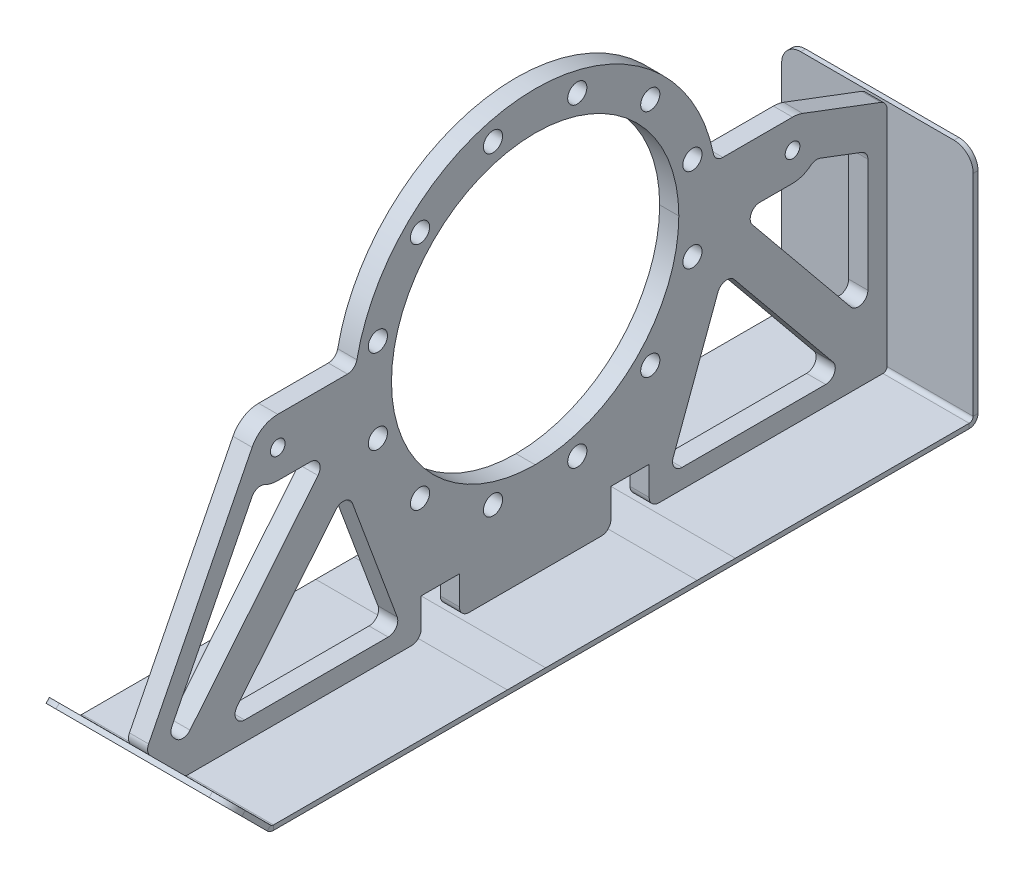
from build123d import *

# Parameters (mm, degrees)
FLANGE_PROFILE_DEPTH                = 12.7
F_7_8_1_DIAMETER_HOLE1_D            = 25.4
BOLT_PATTERN_COUNT                  = 12
SKETCH15_R                          = 9.72312
BOSS_EXTRUDE1_DEPTH                 = 12.7
SKETCH5_W                           = 254
SKETCH5_H                           = 1317.865260112
BASE_SKID_DEPTH                     = 6.35
BEND_START                          = -127
BEND_HEEL_DEPTH                     = 254
BEND_HEEL_2_DEPTH                   = 254
BEND_TOE_DEPTH                      = 254
BEND_TOE_2_DEPTH                    = 254
WEBBING_EXTRUDE_DEPTH               = 12.7
WEBBING_FILLET_R                    = 12.7
SKID_START                          = -472.929130056
SKID_EDGES_DEPTH                    = 6.35
SKID_START_2                        = -334.061851681
SKID_EDGES_2_DEPTH                  = 6.35
FLANGE_FILLET_R                     = 12.7
CONVERT_START                       = -12.7
CONVERT_FLANGE_TO_SHEET_OUTLINE_R   = 12.7
CONVERT_FLANGE_TO_SHEET_OUTLINE_R_2 = 9.72312
CONVERT_FLANGE_TO_SHEET_OUTLINE_R_3 = 190.5
CONVERT_FLANGE_TO_SHEET_DEPTH       = 25.4


# Read off the part's stored shape, not the designer's step: Bend Heel, Bend Toe, Skid Edges, Convert Flange to Sheet
# Sheet-metal steps are written as plain solids
with BuildPart() as part:
    # Sketch1 → Flange Profile (new, symmetric)
    with BuildSketch(Plane(origin=(0, 0, 0), x_dir=(0, 0, -1), z_dir=(1, 0, 0))):
        with BuildLine():
            ThreePointArc((-190.5, 316.3), (0, 506.8), (190.5, 316.3))
            Line((190.5, 316.3), (241.3, 316.3))
            ThreePointArc((241.3, 316.3), (0, 557.6), (-241.3, 316.3))
            Line((-241.3, 316.3), (-190.5, 316.3))
        make_face()
        with BuildLine():
            Line((241.3, 316.3), (190.5, 316.3))
            ThreePointArc((190.5, 316.3), (0, 125.8), (-190.5, 316.3))
            Line((-190.5, 316.3), (-241.3, 316.3))
            ThreePointArc((-241.3, 316.3), (0, 75), (241.3, 316.3))
        make_face()
    extrude(amount=FLANGE_PROFILE_DEPTH, both=True)

    # 7/8 (1) Diameter Hole1 (through all)
    with Locations(Plane(origin=(12.7, 260.420968162, -208.543385896), x_dir=(0, 0, 1), z_dir=(1, 0, 0))):
        with Locations((0, 0)):
            f_7_8_1_diameter_hole1 = Hole(F_7_8_1_DIAMETER_HOLE1_D / 2)

    # Bolt Pattern: 7/8 (1) Diameter Hole1 ×12 about axis
    bolt_pattern_axis = Axis((0, 316.3, 0), (1, 0, 0))
    for i in range(1, BOLT_PATTERN_COUNT):
        add(f_7_8_1_diameter_hole1.rotate(bolt_pattern_axis, i * 360 / BOLT_PATTERN_COUNT), mode=Mode.SUBTRACT)

    # Sketch15 → Boss-Extrude1 (add, symmetric)
    with BuildSketch(Plane(origin=(0, 0, 0), x_dir=(0, 0, -1), z_dir=(1, 0, 0))):
        with BuildLine():
            Line((-238.273120599, 278.2), (-341.3, 278.2))
            ThreePointArc((-341.3, 278.2), (-379.4, 316.3), (-341.3, 354.4))
            Line((-341.3, 354.4), (-238.273120599, 354.4))
            ThreePointArc((-238.273120599, 354.4), (-200.173120599, 316.3), (-238.273120599, 278.2))
        make_face()
        with Locations((-341.3, 316.3)):
            Circle(SKETCH15_R, mode=Mode.SUBTRACT)
    boss_extrude1 = extrude(amount=BOSS_EXTRUDE1_DEPTH, both=True)

    # Mirror2: Boss-Extrude1 across plane
    add(boss_extrude1.mirror(Plane.XY))

    # webbing → Webbing Extrude (add, symmetric)
    with BuildSketch(Plane(origin=(0, 0, 0), x_dir=(0, 0, -1), z_dir=(1, 0, 0))):
        with BuildLine():
            ThreePointArc((238.273120599, 278.2), (0, 75), (-238.273120599, 278.2))
            Line((-238.273120599, 278.2), (-271.07641131, 278.2))
            Line((-271.07641131, 278.2), (-466.535353829, 39.001833116))
            Line((-466.535353829, 39.001833116), (-485.744094857, 58.210574144))
            Line((-485.744094857, 58.210574144), (-380.664844281, 266.473711409))
            Line((-380.664844281, 266.473711409), (-368.819522655, 289.950695021))
            ThreePointArc((-368.819522655, 289.950695021), (-378.982374479, 310.674286388), (-375.315537192, 333.462553119))
            Line((-375.315537192, 333.462553119), (-516.69946035, 53.244915153))
            Line((-516.69946035, 53.244915153), (-465.016837626, 1.562292429))
            ThreePointArc((-465.016837626, 1.562292429), (-463.286363484, 0.406026574), (-461.245130056, 0))
            Line((-461.245130056, 0), (-151.213153751, 0))
            Line((-151.213153751, 0), (-151.213153751, 50.8))
            Line((-151.213153751, 50.8), (-100.413153751, 50.8))
            Line((-100.413153751, 50.8), (-100.413153751, 0))
            Line((-100.413153751, 0), (100.413153751, 0))
            Line((100.413153751, 0), (100.413153751, 50.8))
            Line((100.413153751, 50.8), (151.213153751, 50.8))
            Line((151.213153751, 50.8), (151.213153751, 0))
            Line((151.213153751, 0), (176.613153751, 0))
            Line((176.613153751, 0), (461.245130056, 0))
            ThreePointArc((461.245130056, 0), (465.016837626, 1.562292429), (466.579130056, 5.334))
            Line((466.579130056, 5.334), (466.579130056, 309.66453199))
            Line((466.579130056, 309.66453199), (354.774573435, 351.937702939))
            ThreePointArc((354.774573435, 351.937702939), (378.177611201, 325.873494246), (370.408024073, 291.716816021))
            Line((370.408024073, 291.716816021), (441.179130056, 264.958344347))
            Line((441.179130056, 264.958344347), (441.179130056, 70.03219769))
            Line((441.179130056, 70.03219769), (271.07641131, 278.2))
            Line((271.07641131, 278.2), (238.273120599, 278.2))
        make_face()
        Polygon((-176.613153751, 25.4), (-412.046717792, 25.4), (-250.076782577, 223.615088522), align=None, mode=Mode.SUBTRACT)
        Polygon((412.046717792, 25.4), (176.613153751, 25.4), (250.076782577, 223.615088522), align=None, mode=Mode.SUBTRACT)
    extrude(amount=WEBBING_EXTRUDE_DEPTH, both=True)

    # Webbing Fillet
    webbing_fillet_edges = [part.edges().sort_by_distance(p)[0] for p in [
        (0, 223.615088522, 250.076782577),
        (0, 289.950695021, 368.819522655),
        (0, 291.716816021, -370.408024073),
        (0, 264.958344347, -441.179130056),
        (0, 70.03219769, -441.179130056),
        (0, 278.2, -271.07641131),
        (0, 278.2, 271.07641131),
        (0, 39.001833116, 466.535353829),
        (0, 25.4, -412.046717792),
        (0, 25.4, -176.613153751),
        (0, 58.210574144, 485.744094857),
        (0, 223.615088522, -250.076782577),
        (0, 25.4, 176.613153751),
        (0, 25.4, 412.046717792),
    ]]
    fillet(webbing_fillet_edges, radius=WEBBING_FILLET_R)

    # Flange Fillet
    flange_fillet_edges = [part.edges().sort_by_distance(p)[0] for p in [
        (0, 53.244915153, 516.69946035),
        (0, 0, 151.213153751),
        (0, 0, 100.413153751),
        (0, 0, -100.413153751),
        (0, 0, -151.213153751),
        (0, 309.66453199, -466.579130056),
        (0, 354.4, 238.273120599),
        (0, 354.4, -238.273120599),
    ]]
    fillet(flange_fillet_edges, radius=FLANGE_FILLET_R)


with BuildPart() as body_2:
    # Sketch5 → Base Skid (new body)
    with BuildSketch(Plane(origin=(0, 0, 0), x_dir=(1, 0, 0), z_dir=(0, 1, 0))):
        with Locations((0, 118.6125)):
            Rectangle(SKETCH5_W, SKETCH5_H)
    extrude(amount=-BASE_SKID_DEPTH)

    # Bend Heel outline → Bend Heel (cut)
    with BuildSketch(Plane.YZ.offset(BEND_START)):
        with BuildLine():
            Line((0, -777.545130056), (0, -471.640528076))
            ThreePointArc((0, -471.640528076), (-4.636915504, -467.33583609), (-6.35, -461.245130056))
            Line((-6.35, -461.245130056), (-6.35, -777.545130056))
            Line((-6.35, -777.545130056), (0, -777.545130056))
        make_face()
    extrude(amount=BEND_HEEL_DEPTH, mode=Mode.SUBTRACT)

    # Bend Heel 2 outline → Bend Heel 2 (add)
    with BuildSketch(Plane.YZ.offset(BEND_START)):
        with BuildLine():
            Line((5.334, -472.929130056), (309.66453199, -472.929130056))
            Line((309.66453199, -472.929130056), (309.66453199, -466.579130056))
            Line((309.66453199, -466.579130056), (5.334, -466.579130056))
            ThreePointArc((5.334, -466.579130056), (1.56229243, -465.016837626), (0, -461.245130056))
            Line((0, -461.245130056), (0, -471.640528076))
            ThreePointArc((0, -471.640528076), (2.590277571, -472.602411563), (5.334, -472.929130056))
        make_face()
    extrude(amount=BEND_HEEL_2_DEPTH)

    # Bend Toe outline → Bend Toe (cut)
    with BuildSketch(Plane.YZ.offset(BEND_START)):
        with BuildLine():
            Line((-6.35, 540.320130056), (-6.35, 461.245130056))
            ThreePointArc((-6.35, 461.245130056), (-5.460608458, 465.71640328), (-2.927835631, 469.506965687))
            Line((-2.927835631, 469.506965687), (0, 472.434801318))
            Line((0, 472.434801318), (0, 540.320130056))
            Line((0, 540.320130056), (-6.35, 540.320130056))
        make_face()
    extrude(amount=BEND_TOE_DEPTH, mode=Mode.SUBTRACT)

    # Bend Toe 2 outline → Bend Toe 2 (add)
    with BuildSketch(Plane.YZ.offset(BEND_START)):
        with BuildLine():
            Line((48.754787092, 521.189588411), (0, 472.434801318))
            Line((0, 472.434801318), (0, 461.245130056))
            ThreePointArc((0, 461.245130056), (0.406026574, 463.286363484), (1.562292429, 465.016837626))
            Line((1.562292429, 465.016837626), (53.244915153, 516.69946035))
            Line((53.244915153, 516.69946035), (48.754787092, 521.189588411))
        make_face()
    extrude(amount=BEND_TOE_2_DEPTH)

    # Skid Edges outline → Skid Edges (cut)
    with BuildSketch(Plane.XY.offset(SKID_START)):
        with BuildLine():
            ThreePointArc((-127, 284.26453199), (-119.560512242, 302.225044232), (-101.6, 309.66453199))
            Line((-101.6, 309.66453199), (-127, 309.66453199))
            Line((-127, 309.66453199), (-127, 284.26453199))
        make_face()
        with BuildLine():
            ThreePointArc((101.6, 309.66453199), (119.560512242, 302.225044232), (127, 284.26453199))
            Line((127, 284.26453199), (127, 309.66453199))
            Line((127, 309.66453199), (101.6, 309.66453199))
        make_face()
    extrude(amount=SKID_EDGES_DEPTH, mode=Mode.SUBTRACT)

    # Skid Edges 2 outline → Skid Edges 2 (cut)
    with BuildSketch(Plane(origin=(0, 0, 0), x_dir=(1, 0, 0), z_dir=(0, 0.707106781186546, -0.707106781186549)).offset(SKID_START_2)):
        with BuildLine():
            Line((-127, -403.011532817), (-101.6, -403.011532817))
            ThreePointArc((-101.6, -403.011532817), (-119.560512242, -395.572045059), (-127, -377.611532817))
            Line((-127, -377.611532817), (-127, -403.011532817))
        make_face()
        with BuildLine():
            ThreePointArc((127, -377.611532817), (119.560512242, -395.572045059), (101.6, -403.011532817))
            Line((101.6, -403.011532817), (127, -403.011532817))
            Line((127, -403.011532817), (127, -377.611532817))
        make_face()
    extrude(amount=SKID_EDGES_2_DEPTH, mode=Mode.SUBTRACT)


with BuildPart() as body_3:
    # Convert Flange to Sheet outline → Convert Flange to Sheet (new body)
    with BuildSketch(Plane.YZ.offset(CONVERT_START)):
        with BuildLine():
            ThreePointArc((354.4, 341.3), (348.746134391, 361.271438683), (333.462553119, 375.315537192))
            Line((333.462553119, 375.315537192), (61.448595688, 512.560290001))
            ThreePointArc((61.448595688, 512.560290001), (53.716209529, 513.761463663), (46.747488527, 510.202033725))
            Line((46.747488527, 510.202033725), (1.562292429, 465.016837626))
            ThreePointArc((1.562292429, 465.016837626), (0.406026574, 463.286363484), (0, 461.245130056))
            Line((0, 461.245130056), (0, 163.913153751))
            ThreePointArc((0, 163.913153751), (3.719743879, 154.93289763), (12.7, 151.213153751))
            Line((12.7, 151.213153751), (50.8, 151.213153751))
            Line((50.8, 151.213153751), (50.8, 100.413153751))
            Line((50.8, 100.413153751), (12.7, 100.413153751))
            ThreePointArc((12.7, 100.413153751), (3.719743879, 96.693409872), (0, 87.713153751))
            Line((0, 87.713153751), (0, -87.713153751))
            ThreePointArc((0, -87.713153751), (3.719743879, -96.693409872), (12.7, -100.413153751))
            Line((12.7, -100.413153751), (50.8, -100.413153751))
            Line((50.8, -100.413153751), (50.8, -151.213153751))
            Line((50.8, -151.213153751), (12.7, -151.213153751))
            ThreePointArc((12.7, -151.213153751), (3.719743879, -154.93289763), (0, -163.913153751))
            Line((0, -163.913153751), (0, -461.245130056))
            ThreePointArc((0, -461.245130056), (1.56229243, -465.016837626), (5.334, -466.579130056))
            Line((5.334, -466.579130056), (300.888912587, -466.579130056))
            ThreePointArc((300.888912587, -466.579130056), (308.108595375, -464.327392133), (312.7681469, -458.370654534))
            Line((312.7681469, -458.370654534), (351.937702939, -354.774573435))
            ThreePointArc((351.937702939, -354.774573435), (353.779370872, -348.148850927), (354.4, -341.3))
            Line((354.4, -341.3), (354.4, -248.868157867))
            ThreePointArc((354.4, -248.868157867), (357.262622301, -240.83597261), (364.56, -236.424749973))
            ThreePointArc((364.56, -236.424749973), (557.6, 0), (364.56, 236.424749973))
            ThreePointArc((364.56, 236.424749973), (357.262622301, 240.83597261), (354.4, 248.868157867))
            Line((354.4, 248.868157867), (354.4, 341.3))
        make_face()
        with BuildLine():
            ThreePointArc((46.135994814, -395.102459099), (32.65790179, -396.74310345), (25.4, -385.26819312))
            Line((25.4, -385.26819312), (25.4, -194.864301774))
            ThreePointArc((25.4, -194.864301774), (30.846114958, -184.439756133), (42.513567213, -182.955883556))
            Line((42.513567213, -182.955883556), (202.817491303, -242.368656148))
            ThreePointArc((202.817491303, -242.368656148), (210.931253322, -252.189965766), (206.439918904, -264.111340345))
            Line((206.439918904, -264.111340345), (46.135994814, -395.102459099))
        make_face(mode=Mode.SUBTRACT)
        with BuildLine():
            ThreePointArc((257.464005186, -288.020670003), (270.94209821, -286.380025652), (278.2, -297.854935982))
            Line((278.2, -297.854935982), (278.2, -341.3))
            ThreePointArc((278.2, -341.3), (280.417487243, -354.108406547), (286.811825631, -365.42586936))
            ThreePointArc((286.811825631, -365.42586936), (289.515915106, -371.417982957), (288.861668487, -377.959350292))
            Line((288.861668487, -377.959350292), (268.061959257, -432.970654534))
            ThreePointArc((268.061959257, -432.970654534), (263.402407732, -438.927392133), (256.182724944, -441.179130056))
            Line((256.182724944, -441.179130056), (105.645109911, -441.179130056))
            ThreePointArc((105.645109911, -441.179130056), (93.682978455, -432.744972415), (97.609115097, -418.644864077))
            Line((97.609115097, -418.644864077), (257.464005186, -288.020670003))
        make_face(mode=Mode.SUBTRACT)
        with Locations((107.756614104, -55.879031838)):
            Circle(CONVERT_FLANGE_TO_SHEET_OUTLINE_R, mode=Mode.SUBTRACT)
        with Locations((163.635645942, -152.664354058)):
            Circle(CONVERT_FLANGE_TO_SHEET_OUTLINE_R, mode=Mode.SUBTRACT)
        with Locations((260.420968162, -208.543385896)):
            Circle(CONVERT_FLANGE_TO_SHEET_OUTLINE_R, mode=Mode.SUBTRACT)
        with Locations((316.3, -341.3)):
            Circle(CONVERT_FLANGE_TO_SHEET_OUTLINE_R_2, mode=Mode.SUBTRACT)
        with Locations((372.179031838, -208.543385896)):
            Circle(CONVERT_FLANGE_TO_SHEET_OUTLINE_R, mode=Mode.SUBTRACT)
        with Locations((316.3, 0)):
            Circle(CONVERT_FLANGE_TO_SHEET_OUTLINE_R_3, mode=Mode.SUBTRACT)
        with Locations((468.964354058, -152.664354058)):
            Circle(CONVERT_FLANGE_TO_SHEET_OUTLINE_R, mode=Mode.SUBTRACT)
        with Locations((524.843385896, -55.879031838)):
            Circle(CONVERT_FLANGE_TO_SHEET_OUTLINE_R, mode=Mode.SUBTRACT)
        with Locations((107.756614104, 55.879031838)):
            Circle(CONVERT_FLANGE_TO_SHEET_OUTLINE_R, mode=Mode.SUBTRACT)
        with Locations((163.635645942, 152.664354058)):
            Circle(CONVERT_FLANGE_TO_SHEET_OUTLINE_R, mode=Mode.SUBTRACT)
        with Locations((260.420968162, 208.543385896)):
            Circle(CONVERT_FLANGE_TO_SHEET_OUTLINE_R, mode=Mode.SUBTRACT)
        with BuildLine():
            Line((46.135994814, 395.102459099), (206.439918904, 264.111340345))
            ThreePointArc((206.439918904, 264.111340345), (210.931253322, 252.189965766), (202.817491303, 242.368656148))
            Line((202.817491303, 242.368656148), (42.513567213, 182.955883556))
            ThreePointArc((42.513567213, 182.955883556), (30.846114958, 184.439756133), (25.4, 194.864301774))
            Line((25.4, 194.864301774), (25.4, 385.26819312))
            ThreePointArc((25.4, 385.26819312), (32.65790179, 396.74310345), (46.135994814, 395.102459099))
        make_face(mode=Mode.SUBTRACT)
        with BuildLine():
            ThreePointArc((282.284462808, 358.462553119), (279.235178626, 350.120941928), (278.2, 341.3))
            Line((278.2, 341.3), (278.2, 297.854935982))
            ThreePointArc((278.2, 297.854935982), (270.94209821, 286.380025652), (257.464005186, 288.020670003))
            Line((257.464005186, 288.020670003), (49.87538072, 457.650118027))
            ThreePointArc((49.87538072, 457.650118027), (45.227339921, 466.847798927), (48.931119413, 476.464640127))
            Line((48.931119413, 476.464640127), (51.713147519, 479.246668232))
            ThreePointArc((51.713147519, 479.246668232), (58.68186852, 482.80609817), (66.414254679, 481.604924508))
            Line((66.414254679, 481.604924508), (276.666801451, 375.521916556))
            ThreePointArc((276.666801451, 375.521916556), (283.00874198, 368.155690599), (282.284462808, 358.462553119))
        make_face(mode=Mode.SUBTRACT)
        with Locations((372.179031838, 208.543385896)):
            Circle(CONVERT_FLANGE_TO_SHEET_OUTLINE_R, mode=Mode.SUBTRACT)
        with Locations((524.843385896, 55.879031838)):
            Circle(CONVERT_FLANGE_TO_SHEET_OUTLINE_R, mode=Mode.SUBTRACT)
        with Locations((468.964354058, 152.664354058)):
            Circle(CONVERT_FLANGE_TO_SHEET_OUTLINE_R, mode=Mode.SUBTRACT)
        with Locations((316.3, 341.3)):
            Circle(CONVERT_FLANGE_TO_SHEET_OUTLINE_R_2, mode=Mode.SUBTRACT)
    extrude(amount=CONVERT_FLANGE_TO_SHEET_DEPTH)


solid = Compound([body_2.part, body_3.part])
